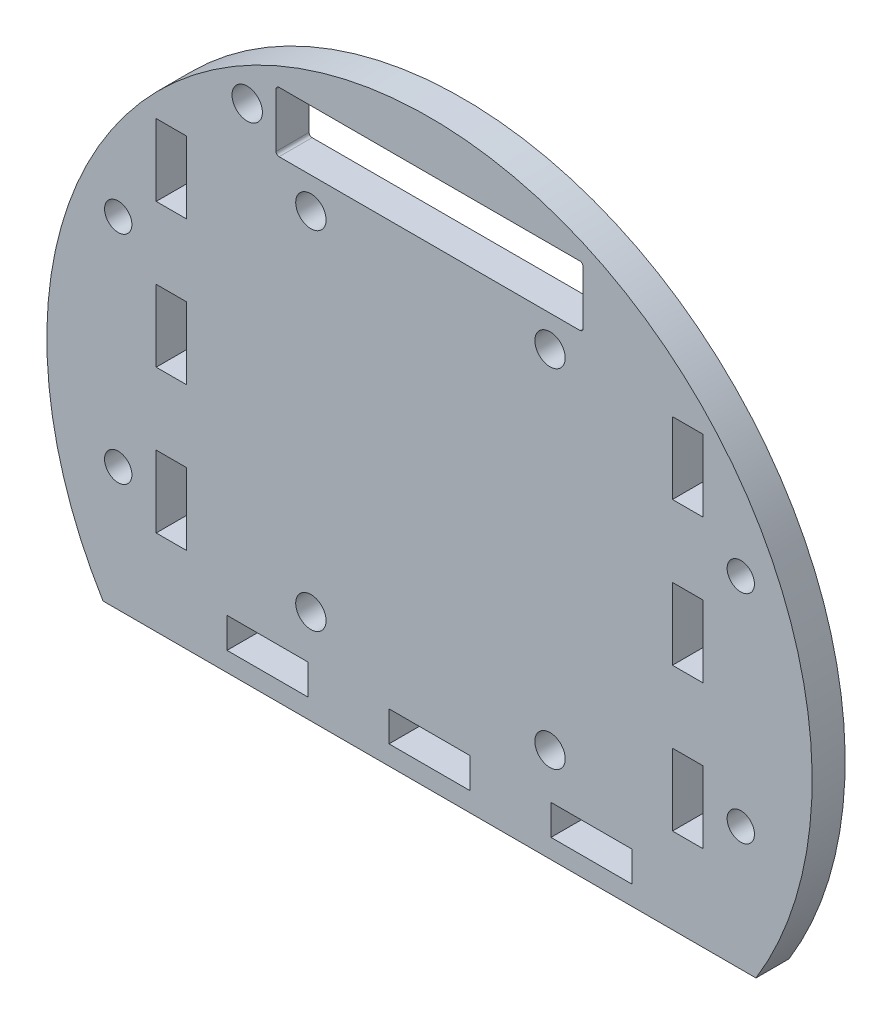
from build123d import *

# Parameters (mm, degrees)
SKETCH1_R           = 2.25
SKETCH1_R_2         = 2.5
SKETCH1_W           = 13.333333333
SKETCH1_H           = 4.9958
SKETCH1_W_2         = 13.333333334
SKETCH1_W_3         = 4.9958
SKETCH1_H_2         = 11.818181818
SKETCH1_H_3         = 11.818181819
BOSS_EXTRUDE1_DEPTH = 5.4356


with BuildPart() as part:
    # Sketch1 → Boss-Extrude1 (new body)
    with BuildSketch(Plane.XY):
        with BuildLine():
            Line((-53.750203106, -32.862070326), (53.750203106, -32.862070326))
            ThreePointArc((53.750203106, -32.862070326), (0, 63), (-53.750203106, -32.862070326))
        make_face()
        with Locations((-51.25, 23.184046239)):
            Circle(SKETCH1_R, mode=Mode.SUBTRACT)
        with Locations((-51.25, -12.496398734)):
            Circle(SKETCH1_R, mode=Mode.SUBTRACT)
        with Locations((-30.011103704, 49.928449687)):
            Circle(SKETCH1_R_2, mode=Mode.SUBTRACT)
        with Locations((51.25, 23.184046239)):
            Circle(SKETCH1_R, mode=Mode.SUBTRACT)
        with Locations((51.25, -12.496398734)):
            Circle(SKETCH1_R, mode=Mode.SUBTRACT)
        with Locations((-19.525679125, 39.833449687)):
            Circle(SKETCH1_R_2, mode=Mode.SUBTRACT)
        with Locations((-19.525679125, -17.316550313)):
            Circle(SKETCH1_R_2, mode=Mode.SUBTRACT)
        with Locations((19.844320875, -17.316550313)):
            Circle(SKETCH1_R_2, mode=Mode.SUBTRACT)
        with Locations((19.844320875, 39.833449687)):
            Circle(SKETCH1_R_2, mode=Mode.SUBTRACT)
        with Locations((26.666666666, -27.189170326)):
            Rectangle(SKETCH1_W, SKETCH1_H, mode=Mode.SUBTRACT)
        with Locations((0, -27.189170326)):
            Rectangle(SKETCH1_W_2, SKETCH1_H, mode=Mode.SUBTRACT)
        with Locations((-26.666666666, -27.189170326)):
            Rectangle(SKETCH1_W, SKETCH1_H, mode=Mode.SUBTRACT)
        with Locations((-42.4979, -12.873088508)):
            Rectangle(SKETCH1_W_3, SKETCH1_H_2, mode=Mode.SUBTRACT)
        with Locations((-42.4979, 10.763275129)):
            Rectangle(SKETCH1_W_3, SKETCH1_H_3, mode=Mode.SUBTRACT)
        with Locations((-42.4979, 34.399638765)):
            Rectangle(SKETCH1_W_3, SKETCH1_H_2, mode=Mode.SUBTRACT)
        with Locations((42.4979, -12.873088508)):
            Rectangle(SKETCH1_W_3, SKETCH1_H_2, mode=Mode.SUBTRACT)
        with Locations((42.4979, 10.763275129)):
            Rectangle(SKETCH1_W_3, SKETCH1_H_3, mode=Mode.SUBTRACT)
        with Locations((42.4979, 34.399638765)):
            Rectangle(SKETCH1_W_3, SKETCH1_H_2, mode=Mode.SUBTRACT)
        with BuildLine():
            Line((25.265, 45.483449687), (25.265, 54.373449687))
            ThreePointArc((25.265, 54.373449687), (25.118553391, 54.727003078), (24.765, 54.873449687))
            Line((24.765, 54.873449687), (-24.765, 54.873449687))
            ThreePointArc((-24.765, 54.873449687), (-25.118553391, 54.727003078), (-25.265, 54.373449687))
            Line((-25.265, 54.373449687), (-25.265, 45.483449687))
            ThreePointArc((-25.265, 45.483449687), (-25.118553391, 45.129896297), (-24.765, 44.983449687))
            Line((-24.765, 44.983449687), (24.765, 44.983449687))
            ThreePointArc((24.765, 44.983449687), (25.118553391, 45.129896297), (25.265, 45.483449687))
        make_face(mode=Mode.SUBTRACT)
    extrude(amount=-BOSS_EXTRUDE1_DEPTH)


solid = part.part
